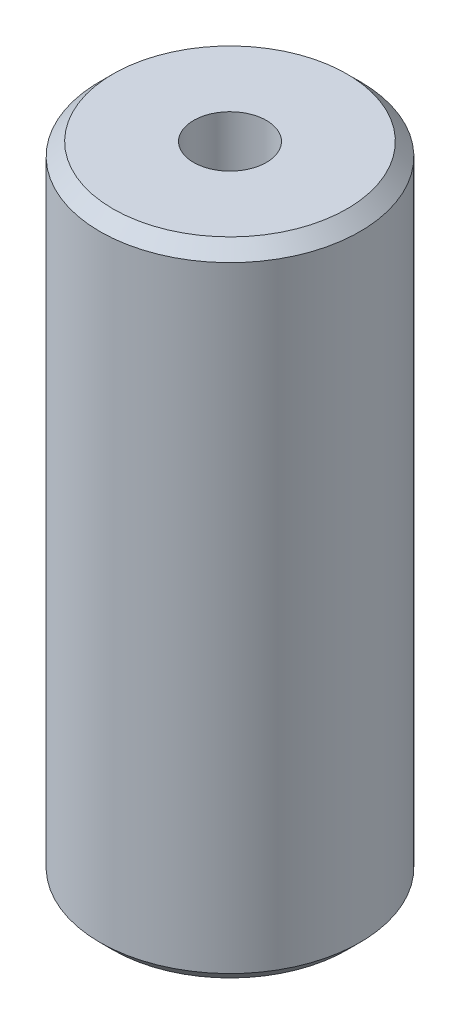
from build123d import *

# Parameters (mm, degrees)
SKETCH1_R           = 17.5
BOSS_EXTRUDE1_DEPTH = 86.380499031
SKETCH2_R           = 4.902692089
CUT_EXTRUDE1_DEPTH  = 90.85594367
CHAMFER1_SIZE       = 1.759758845


with BuildPart() as part:
    # Sketch1 → Boss-Extrude1 (new body)
    with BuildSketch(Plane(origin=(0, 0, 0), x_dir=(1, 0, 0), z_dir=(0, 1, 0))):
        Circle(SKETCH1_R)
    extrude(amount=BOSS_EXTRUDE1_DEPTH)

    # Sketch2 → Cut-Extrude1 (cut, through all)
    with BuildSketch(Plane(origin=(0, 0, 0), x_dir=(1, 0, 0), z_dir=(0, 1, 0))):
        Circle(SKETCH2_R)
    extrude(amount=CUT_EXTRUDE1_DEPTH, mode=Mode.SUBTRACT)

    # Chamfer1
    chamfer1_edges = [part.edges().sort_by_distance(p)[0] for p in [
        (-17.5, 86.380499031, 0),
        (-17.5, 0, 0),
    ]]
    chamfer(chamfer1_edges, length=CHAMFER1_SIZE)


solid = part.part
